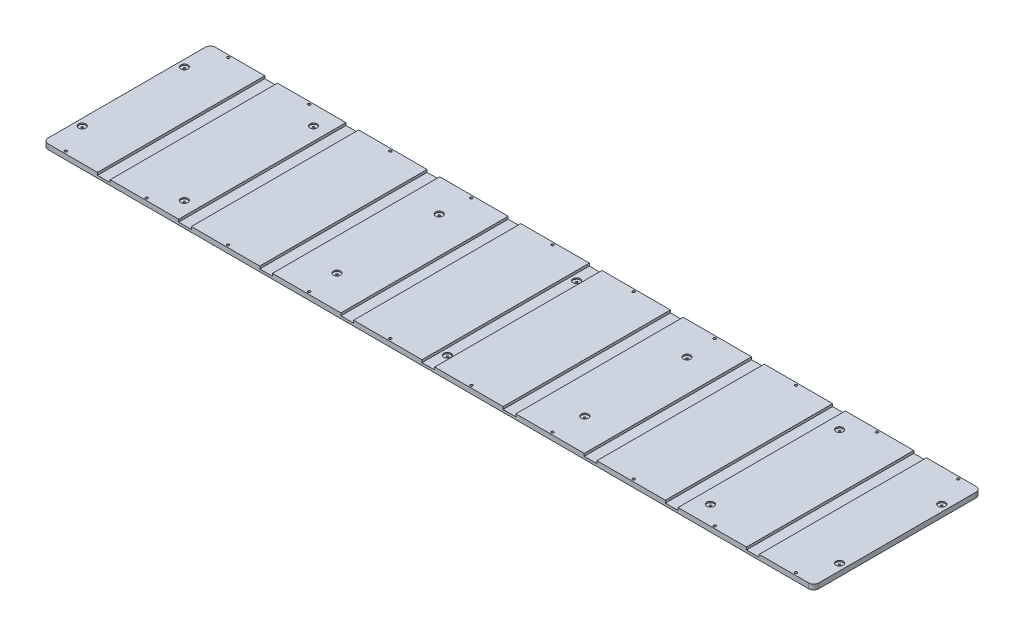
from build123d import *

# Parameters (mm, degrees)
SKETCH1_W                                           = 1930.4
SKETCH1_H                                           = 419.1
BOSS_EXTRUDE1_DEPTH                                 = 12.7
FILLET1_R                                           = 12.7
SKETCH8_W                                           = 31.75
SKETCH8_H                                           = 419.1
CUT_EXTRUDE3_DEPTH                                  = 6.35
F_1_4_0_25_DIAMETER_HOLE1_D                         = 6.35
CBORE_FOR_10_SOCKET_HEAD_CAP_SCREW1_D               = 4.9022
CBORE_FOR_10_SOCKET_HEAD_CAP_SCREW1_CBORE_D         = 18.0975
CBORE_FOR_10_SOCKET_HEAD_CAP_SCREW1_CBORE_DEPTH     = 3.175
CBORE_FOR_10_BINDING_HEAD_MACHINE_SCREW_D           = 4.9022
CBORE_FOR_10_BINDING_HEAD_MACHINE_SCREW_CBORE_D     = 18.0975
CBORE_FOR_10_BINDING_HEAD_MACHINE_SCREW_CBORE_DEPTH = 3.175


with BuildPart() as part:
    # Sketch1 → Boss-Extrude1 (new body)
    with BuildSketch(Plane(origin=(0, 0, 0), x_dir=(1, 0, 0), z_dir=(0, 1, 0))):
        with Locations((965.2, 209.55)):
            Rectangle(SKETCH1_W, SKETCH1_H)
    extrude(amount=BOSS_EXTRUDE1_DEPTH)

    # Fillet1
    fillet1_edges = [part.edges().sort_by_distance(p)[0] for p in [
        (1930.4, 6.35, 0),
        (1930.4, 6.35, -419.1),
        (0, 6.35, 0),
        (0, 6.35, -419.1),
    ]]
    fillet(fillet1_edges, radius=FILLET1_R)

    # Sketch8 → Cut-Extrude3 (cut)
    with BuildSketch(Plane(origin=(0, 12.7, 0), x_dir=(1, 0, 0), z_dir=(0, 1, 0))):
        with Locations((152.4, 209.55)):
            Rectangle(SKETCH8_W, SKETCH8_H)
        with Locations((355.6, 209.55)):
            Rectangle(SKETCH8_W, SKETCH8_H)
        with Locations((558.8, 209.55)):
            Rectangle(SKETCH8_W, SKETCH8_H)
        with Locations((762, 209.55)):
            Rectangle(SKETCH8_W, SKETCH8_H)
        with Locations((965.2, 209.55)):
            Rectangle(SKETCH8_W, SKETCH8_H)
        with Locations((1168.4, 209.55)):
            Rectangle(SKETCH8_W, SKETCH8_H)
        with Locations((1371.6, 209.55)):
            Rectangle(SKETCH8_W, SKETCH8_H)
        with Locations((1574.8, 209.55)):
            Rectangle(SKETCH8_W, SKETCH8_H)
        with Locations((1778, 209.55)):
            Rectangle(SKETCH8_W, SKETCH8_H)
    extrude(amount=-CUT_EXTRUDE3_DEPTH, mode=Mode.SUBTRACT)

    # 1/4 (0.25) Diameter Hole1 (through all)
    with Locations(Plane(origin=(0, 12.7, 0), x_dir=(1, 0, 0), z_dir=(0, 1, 0))):
        with Locations((254, 6.35), (457.2, 6.35), (660.4, 6.35), (863.6, 6.35), (1066.8, 6.35), (1270, 6.35), (1473.2, 6.35), (1676.4, 6.35), (50.8, 6.35), (1879.6, 6.35), (1676.4, 412.75), (1879.6, 412.75), (50.8, 412.75), (1473.2, 412.75), (1270, 412.75), (1066.8, 412.75), (863.6, 412.75), (660.4, 412.75), (457.2, 412.75), (254, 412.75)):
            Hole(F_1_4_0_25_DIAMETER_HOLE1_D / 2)

    # CBORE for #10 Socket Head Cap Screw1 (through all)
    with Locations(Plane(origin=(0, 12.7, 0), x_dir=(1, 0, 0), z_dir=(0, 1, 0))):
        with Locations((16.66875, 337.566), (16.66875, 81.534), (306.324, 47.752), (306.324, 371.348), (654.84375, 337.566), (654.84375, 81.534), (965.2, 371.348), (965.2, 47.752), (1275.55625, 81.534), (1275.55625, 337.566), (1624.076, 371.348), (1624.076, 47.752), (1913.73125, 81.534), (1913.73125, 337.566)):
            CounterBoreHole(CBORE_FOR_10_SOCKET_HEAD_CAP_SCREW1_D / 2, CBORE_FOR_10_SOCKET_HEAD_CAP_SCREW1_CBORE_D / 2, CBORE_FOR_10_SOCKET_HEAD_CAP_SCREW1_CBORE_DEPTH)

    # CBORE for #10 Binding Head Machine Screw1 (through all)
    with Locations(Plane(origin=(0, 6.35, 0), x_dir=(1, 0, 0), z_dir=(0, 1, 0))):
        with Locations((965.2, 371.348), (965.2, 47.752)):
            CounterBoreHole(CBORE_FOR_10_BINDING_HEAD_MACHINE_SCREW_D / 2, CBORE_FOR_10_BINDING_HEAD_MACHINE_SCREW_CBORE_D / 2, CBORE_FOR_10_BINDING_HEAD_MACHINE_SCREW_CBORE_DEPTH)


solid = part.part
